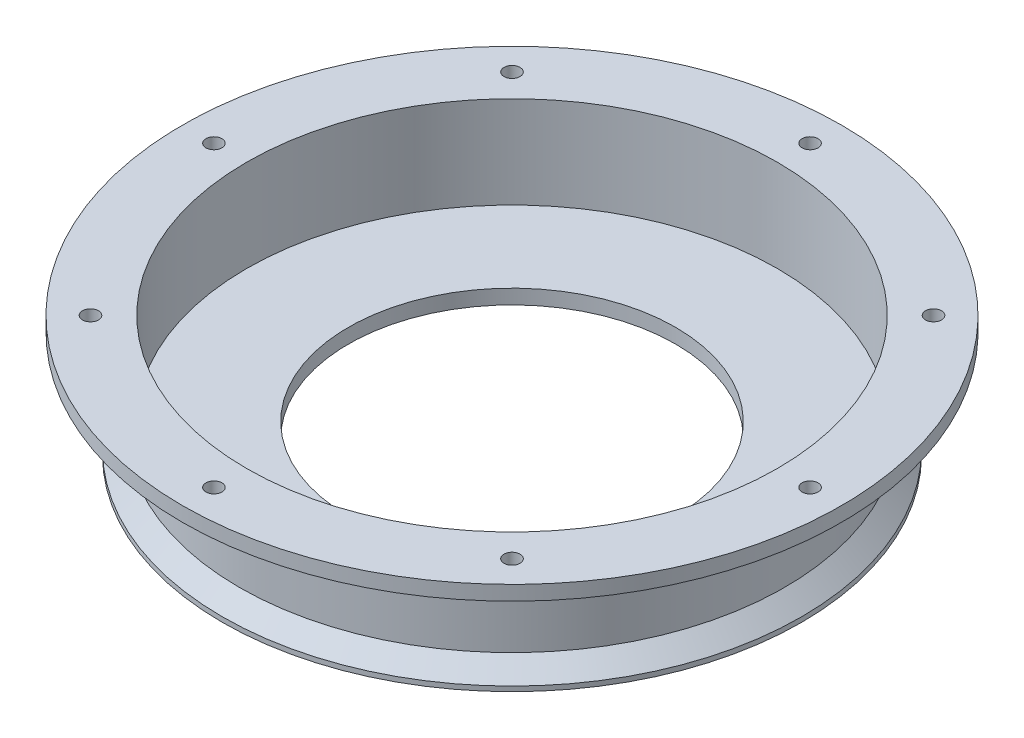
from build123d import *

# Parameters (mm, degrees)
SKETCH_2_R               = 3.3
BASE_PLATE_M6_DEPTH      = 198.301799282
PATTERN_CIRCULAR_1_COUNT = 8


with BuildPart() as part:
    # ｽｹｯﾁ1 → 回転1 (revolve)
    with BuildSketch(Plane.XY):
        Polygon((-109.5, 26.845447074), (-136, 26.845447074), (-136, 20.845447074), (-112.5, 20.845447074), (-112.5, -14.154552926), (-119.5, -21.154552926), (-119.5, -23.154552926), (-110, -23.154552926), (-104, -17.154552926), (-67.5, -17.154552926), (-67.5, -11.154552926), (-109.5, -11.154552926), align=None)
    revolve(axis=Axis((0, 100.817249739, 0), (0, -1, 0)))

    # ｽｹｯﾁ2 → Base_Plateへの固定用穴(M6の六角ボルトを使用) (cut, through all)
    with BuildSketch(Plane.XZ.offset(-20.845447074)):
        with Locations((123, 0)):
            Circle(SKETCH_2_R)
    base_plate_m6 = extrude(amount=-BASE_PLATE_M6_DEPTH, mode=Mode.SUBTRACT)

    # 円形ﾊﾟﾀｰﾝ1: Base_Plateへの固定用穴(M6の六角ボルトを使用) ×8 about axis
    pattern_circular_1_axis = Axis((0, 35.178366508, 0), (0, 1, 0))
    for i in range(1, PATTERN_CIRCULAR_1_COUNT):
        add(base_plate_m6.rotate(pattern_circular_1_axis, i * 360 / PATTERN_CIRCULAR_1_COUNT), mode=Mode.SUBTRACT)


solid = part.part
